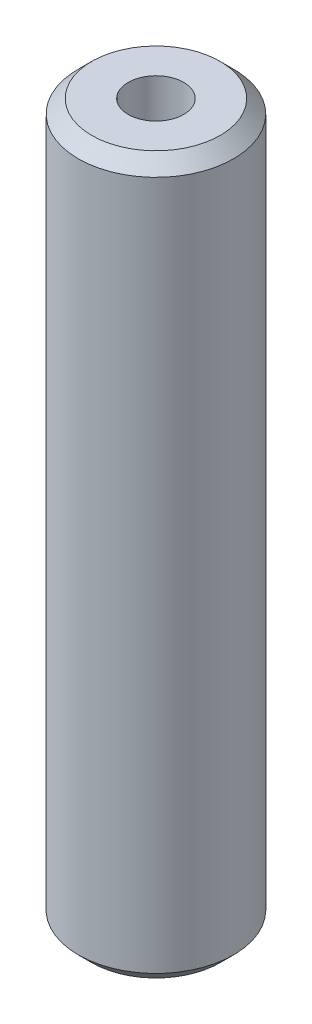
from build123d import *

# Parameters (mm, degrees)
SKETCH1_R           = 27.5
BOSS_EXTRUDE1_DEPTH = 253.677838348
SKETCH2_R           = 9.839116078
CUT_EXTRUDE1_DEPTH  = 257.641667835
CHAMFER1_SIZE       = 4.771353879


with BuildPart() as part:
    # Sketch1 → Boss-Extrude1 (new body)
    with BuildSketch(Plane(origin=(0, 0, 0), x_dir=(1, 0, 0), z_dir=(0, 1, 0))):
        Circle(SKETCH1_R)
    extrude(amount=BOSS_EXTRUDE1_DEPTH)

    # Sketch2 → Cut-Extrude1 (cut, through all)
    with BuildSketch(Plane(origin=(0, 0, 0), x_dir=(1, 0, 0), z_dir=(0, 1, 0))):
        Circle(SKETCH2_R)
    extrude(amount=CUT_EXTRUDE1_DEPTH, mode=Mode.SUBTRACT)

    # Chamfer1
    chamfer1_edges = [part.edges().sort_by_distance(p)[0] for p in [
        (-27.5, 253.677838348, 0),
        (-27.5, 0, 0),
    ]]
    chamfer(chamfer1_edges, length=CHAMFER1_SIZE)


solid = part.part
